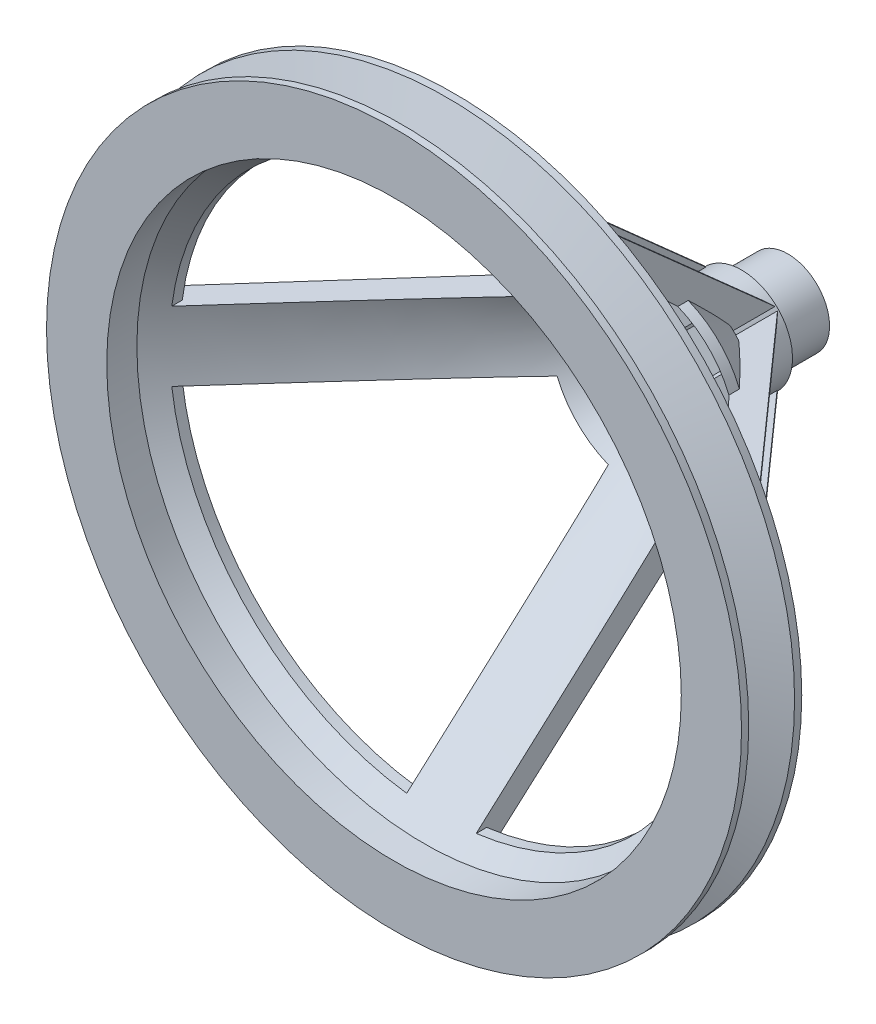
from build123d import *

# Parameters (mm, degrees)
EXTRUDE_START                      = 52
SKETCH_5_R                         = 11
EXTRUDE_1_DEPTH                    = 10
SKETCH_6_R                         = 9
EXTRUDE_2_DEPTH                    = 10
CUT_EXTRUDE_1_DEPTH                = 136.922772191
CUT_EXTRUDE_1_DEPTH_BACK           = 136.922772191
FILLET_1_R                         = 2
RIB_1_REACH                        = 133.955
SKETCH_14_WALL_W                   = 343.038740056
SKETCH_14_WALL_H                   = 1
RIB_2_REACH                        = 138.056
SKETCH_15_WALL_W                   = 359.167216718
SKETCH_15_WALL_H                   = 1
PATTERN_CIRCULAR_2_COUNT           = 4
PATTERN_CIRCULAR_2_COPY_1_REACH    = 138.056
PATTERN_CIRCULAR_2_COPY_1_SKETCH_W = 359.167216718
PATTERN_CIRCULAR_2_COPY_1_SKETCH_H = 1
PATTERN_CIRCULAR_2_COPY_2_REACH    = 138.056
PATTERN_CIRCULAR_2_COPY_2_SKETCH_W = 359.167216718
PATTERN_CIRCULAR_2_COPY_2_SKETCH_H = 1
PATTERN_CIRCULAR_2_COPY_3_REACH    = 138.056
PATTERN_CIRCULAR_2_COPY_3_SKETCH_W = 359.167216718
PATTERN_CIRCULAR_2_COPY_3_SKETCH_H = 1
CUT_EXTRUDE_2_DEPTH                = 132.955484918
PATTERN_CIRCULAR_3_COUNT           = 4


with BuildPart() as part:
    # 草图3 → 旋转1 (revolve)
    with BuildSketch(Plane(origin=(0, 0, 0), x_dir=(0, 0, -1), z_dir=(1, 0, 0)), mode=Mode.PRIVATE) as revolve_1_sk:
        Polygon((-6.5, 62), (-6.5, 75), (-4.95, 75), (-1.265694538, 64.3), (1.265694538, 64.3), (4.95, 75), (6.5, 75), (6.5, 62), align=None)
    revolve(revolve_1_sk.sketch.rotate(Axis((0, 0, 0), (0, 0, 1)), 90), axis=Axis((0, 0, 0), (0, 0, 1)))



with BuildPart() as body_2:
    # 草图5 → 凸台-拉伸1 (new body)
    with BuildSketch(Plane(origin=(0, 0, -6.5), x_dir=(-1, 0, 0), z_dir=(0, 0, -1)).offset(EXTRUDE_START)):
        Circle(SKETCH_5_R)
    extrude(amount=EXTRUDE_1_DEPTH)

    # 草图6 → 凸台-拉伸2 (add)
    with BuildSketch(Plane(origin=(0, 0, -68.5), x_dir=(-1, 0, 0), z_dir=(0, 0, -1))):
        Circle(SKETCH_6_R)
    extrude(amount=EXTRUDE_2_DEPTH)

    # 草图7 → 切除-拉伸1 (cut, two sides: drawn at the far end of the back side and taken through both)
    with BuildSketch(Plane(origin=(0, 0, -78.5), x_dir=(-1, 0, 0), z_dir=(0, 0, -1)).offset(-CUT_EXTRUDE_1_DEPTH_BACK)):
        Polygon((0.353553391, 6.01040764), (-0.353553391, 6.01040764), (-6.01040764, 0.353553391), (-6.01040764, -0.353553391), (-0.353553391, -6.01040764), (0.353553391, -6.01040764), (6.01040764, -0.353553391), (6.01040764, 0.353553391), align=None)
    extrude(amount=CUT_EXTRUDE_1_DEPTH + CUT_EXTRUDE_1_DEPTH_BACK, mode=Mode.SUBTRACT)


with BuildPart() as part_1:
    add(part.part)

    add(body_2.part)  # 旋转2 merges body 2
    # 草图10 → 旋转2 (revolve)
    with BuildSketch(Plane(origin=(0, 0, 0), x_dir=(0, 0, -1), z_dir=(1, 0, 0)), mode=Mode.PRIVATE) as revolve_2_sk:
        Polygon((58.5, 10), (0, 62), (2.257798984, 62), (58.5, 12.00693243), align=None)
    revolve(revolve_2_sk.sketch.rotate(Axis((0, 0, 0), (0, 0, -1)), 90), axis=Axis((0, 0, 0), (0, 0, -1)))

    # 圆角1
    # the kernel refuses this fillet: 2 mm, written as the material it adds along each edge
    with BuildSketch(Plane(origin=(0, 0, -2.257798984), x_dir=(-1, 0, 0), z_dir=(0, -1, 0))) as fillet_1_piece_1:
        with BuildLine():
            CenterArc((60.175945418, 5.06246005), FILLET_1_R, 221.633539337, 114.153489576)
            Line((62, 4.242201016), (62.036481092, 4.225795836))
            ThreePointArc((62.036481092, 4.225795836), (62.04, 2.121100508), (62.04, 0))
            Line((62.04, 0), (61.970103627, -0.026574554))
            Line((61.970103627, -0.026574554), (58.651230408, 3.707157818))
            Line((58.651230408, 3.707157818), (58.681126781, 3.733732372))
        make_face()
    revolve(axis=Axis((0, 0, -2.257798984), (0, 0, -1)), revolution_arc=180)
    with BuildSketch(Plane(origin=(0, 0, -2.257798984), x_dir=(1, 0, 0), z_dir=(0, 1, 0))) as fillet_1_piece_2:
        with BuildLine():
            CenterArc((60.175945418, 5.06246005), FILLET_1_R, 221.633539337, 114.153489576)
            Line((62, 4.242201016), (62.036481092, 4.225795836))
            ThreePointArc((62.036481092, 4.225795836), (62.04, 2.121100508), (62.04, 0))
            Line((62.04, 0), (61.970103627, -0.026574554))
            Line((61.970103627, -0.026574554), (58.651230408, 3.707157818))
            Line((58.651230408, 3.707157818), (58.681126781, 3.733732372))
        make_face()
    revolve(axis=Axis((0, 0, -2.257798984), (0, 0, -1)), revolution_arc=180)

    # 草图14 wall → 筋1 (add, up to next)
    with BuildSketch(Plane(origin=(36.620450752, 0, -33.820190532), x_dir=(0.66436383883, 0, 0.747409318684), z_dir=(0.747409318684, 0, -0.66436383883)), mode=Mode.PRIVATE) as rib_1_sk1:
        Rectangle(SKETCH_14_WALL_W, SKETCH_14_WALL_H)
    rib_1_tool1 = extrude(rib_1_sk1.sketch, amount=-RIB_1_REACH, mode=Mode.PRIVATE) - part_1.part
    rib_1 = rib_1_tool1.solids().sort_by_distance((36.620450752, 0, -33.820190532))[0]
    add(rib_1)

    # 草图15 wall → 筋2 (add, up to next)
    with BuildSketch(Plane(origin=(36.054654732, 7, -36.714510038), x_dir=(0.664363838828, 0, 0.747409318685), z_dir=(0.747409318685, 0, -0.664363838828)), mode=Mode.PRIVATE) as rib_2_sk1:
        Rectangle(SKETCH_15_WALL_W, SKETCH_15_WALL_H)
    rib_2_tool1 = extrude(rib_2_sk1.sketch, amount=-RIB_2_REACH, mode=Mode.PRIVATE) - part_1.part
    rib_2 = rib_2_tool1.solids().sort_by_distance((36.054654732, 7, -36.714510038))[0]
    add(rib_2)

    # 镜向1: 筋2 across plane
    add(rib_2.mirror(Plane.ZX))

    # 阵列(圆周)2: 筋1, 筋2 ×4 about axis
    pattern_circular_2_axis = Axis((0, 0, 0), (0, 0, 1))
    add([rib_1.rotate(pattern_circular_2_axis, i * 360 / PATTERN_CIRCULAR_2_COUNT) for i in range(1, PATTERN_CIRCULAR_2_COUNT)])
    add([rib_2.rotate(pattern_circular_2_axis, i * 360 / PATTERN_CIRCULAR_2_COUNT) for i in range(1, PATTERN_CIRCULAR_2_COUNT)])

    # 阵列(圆周)2 copy 1 sketch → 阵列(圆周)2 copy 1 (add, up to next)
    with BuildSketch(Plane(origin=(7, 36.054654732, -36.714510038), x_dir=(0, 0.664363838828, 0.747409318685), z_dir=(0, 0.747409318685, -0.664363838828)), mode=Mode.PRIVATE) as pattern_circular_2_copy_1_sk1:
        Rectangle(PATTERN_CIRCULAR_2_COPY_1_SKETCH_W, PATTERN_CIRCULAR_2_COPY_1_SKETCH_H)
    pattern_circular_2_copy_1_tool1 = extrude(pattern_circular_2_copy_1_sk1.sketch, amount=-PATTERN_CIRCULAR_2_COPY_1_REACH, mode=Mode.PRIVATE) - part_1.part
    add(pattern_circular_2_copy_1_tool1.solids().sort_by_distance((7, 36.054654732, -36.714510038))[0])

    # 阵列(圆周)2 copy 2 sketch → 阵列(圆周)2 copy 2 (add, up to next)
    with BuildSketch(Plane(origin=(-36.054654732, 7, -36.714510038), x_dir=(-0.664363838828, 0, 0.747409318685), z_dir=(-0.747409318685, 0, -0.664363838828)), mode=Mode.PRIVATE) as pattern_circular_2_copy_2_sk1:
        Rectangle(PATTERN_CIRCULAR_2_COPY_2_SKETCH_W, PATTERN_CIRCULAR_2_COPY_2_SKETCH_H)
    pattern_circular_2_copy_2_tool1 = extrude(pattern_circular_2_copy_2_sk1.sketch, amount=-PATTERN_CIRCULAR_2_COPY_2_REACH, mode=Mode.PRIVATE) - part_1.part
    add(pattern_circular_2_copy_2_tool1.solids().sort_by_distance((-36.054654732, 7, -36.714510038))[0])

    # 阵列(圆周)2 copy 3 sketch → 阵列(圆周)2 copy 3 (add, up to next)
    with BuildSketch(Plane(origin=(-7, -36.054654732, -36.714510038), x_dir=(0, -0.664363838828, 0.747409318685), z_dir=(0, -0.747409318685, -0.664363838828)), mode=Mode.PRIVATE) as pattern_circular_2_copy_3_sk1:
        Rectangle(PATTERN_CIRCULAR_2_COPY_3_SKETCH_W, PATTERN_CIRCULAR_2_COPY_3_SKETCH_H)
    pattern_circular_2_copy_3_tool1 = extrude(pattern_circular_2_copy_3_sk1.sketch, amount=-PATTERN_CIRCULAR_2_COPY_3_REACH, mode=Mode.PRIVATE) - part_1.part
    add(pattern_circular_2_copy_3_tool1.solids().sort_by_distance((-7, -36.054654732, -36.714510038))[0])

    # 草图16 → 切除-拉伸2 (cut, symmetric)
    with BuildSketch(Plane.XY):
        with BuildLine():
            Line((-7.5, -18.540496218), (-7.5, -58.199868043))
            ThreePointArc((-7.5, -58.199868043), (-41.493822674, -41.493822674), (-58.199868043, -7.5))
            Line((-58.199868043, -7.5), (-18.540496218, -7.5))
            ThreePointArc((-18.540496218, -7.5), (-14.142135624, -14.142135624), (-7.5, -18.540496218))
        make_face()
    cut_extrude_2 = extrude(amount=CUT_EXTRUDE_2_DEPTH, both=True, mode=Mode.SUBTRACT)

    # 阵列(圆周)3: 切除-拉伸2 ×4 about axis
    pattern_circular_3_axis = Axis((0, 0, 6.5), (0, 0, -1))
    for i in range(1, PATTERN_CIRCULAR_3_COUNT):
        add(cut_extrude_2.rotate(pattern_circular_3_axis, i * 360 / PATTERN_CIRCULAR_3_COUNT), mode=Mode.SUBTRACT)


solid = part_1.part
